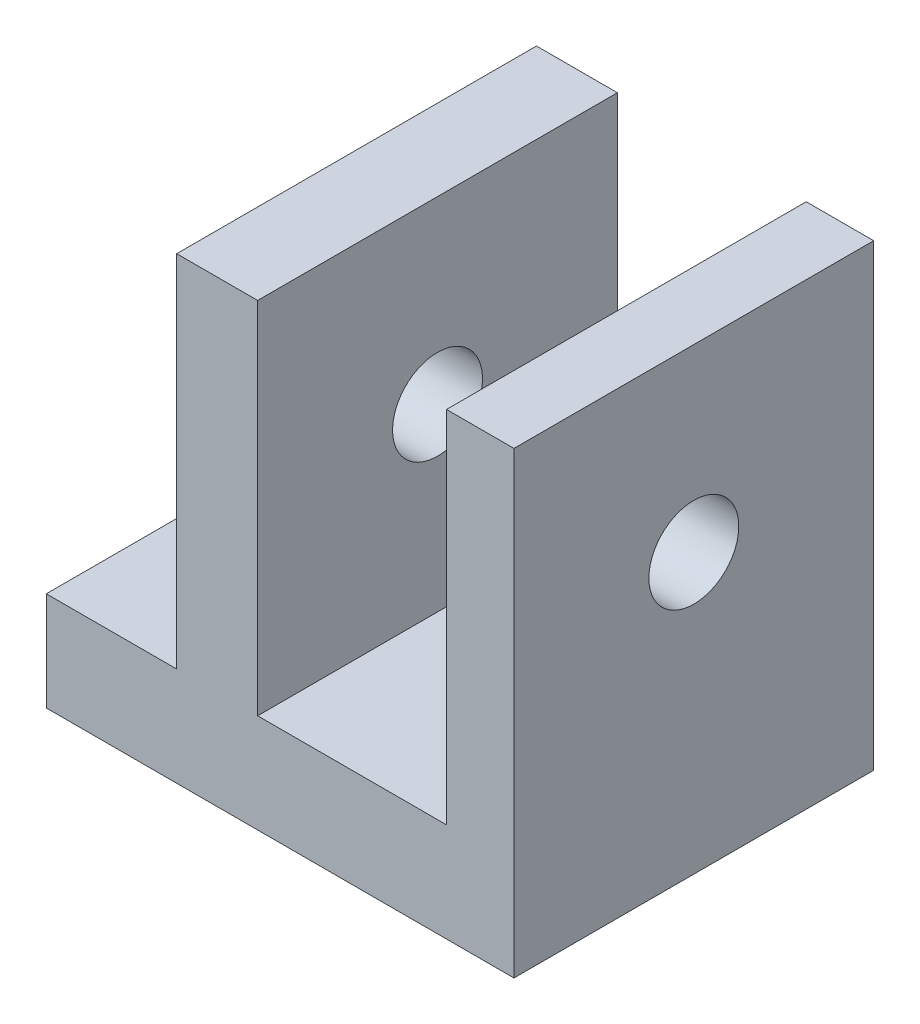
from build123d import *

# Parameters (mm, degrees)
BODY_START           = -10
BODY_DEPTH           = 20
M3_CLEARANCE_HOLE1_D = 3.4
CUT_EXTRUDE1_REACH   = 34.243
SKETCH4_R            = 2.5


# Read off the part's stored shape, not the designer's step: Body
with BuildPart() as part:
    # Body outline → Body (new body)
    with BuildSketch(Plane.XY.offset(BODY_START)):
        Polygon((9.25, 24.25), (9.25, 4.25), (-1.25, 4.25), (-1.25, 24.25), (-5.75, 24.25), (-5.75, 4.25), (-13, 4.25), (-13, -1.25), (13, -1.25), (13, 24.25), align=None)
    extrude(amount=BODY_DEPTH)

    # M3 Clearance Hole1 (through all)
    with Locations(Plane(origin=(0, -1.25, 0), x_dir=(-1, 0, 0), z_dir=(0, -1, 0))):
        with Locations((9, -3), (9, 3)):
            Hole(M3_CLEARANCE_HOLE1_D / 2)

    # Cut-Extrude1: up to this face of the body (flat: up to its plane)
    cut_extrude1_end = Plane(part.part.faces().sort_by_distance((13, 11.5, 0))[0])
    # Sketch4 → Cut-Extrude1 (cut, up to the picked face)
    with BuildSketch(Plane.ZY.offset(5.75), mode=Mode.PRIVATE) as cut_extrude1_sk1:
        with Locations((0, 14.25)):
            Circle(SKETCH4_R)
    cut_extrude1_tool1 = split(extrude(cut_extrude1_sk1.sketch, amount=-CUT_EXTRUDE1_REACH, mode=Mode.PRIVATE), bisect_by=cut_extrude1_end, keep=Keep.BOTH, mode=Mode.PRIVATE)
    add(cut_extrude1_tool1.solids().sort_by(Axis((-5.75, 14.25, 0), (1, 0, 0)))[0], mode=Mode.SUBTRACT)


solid = part.part
